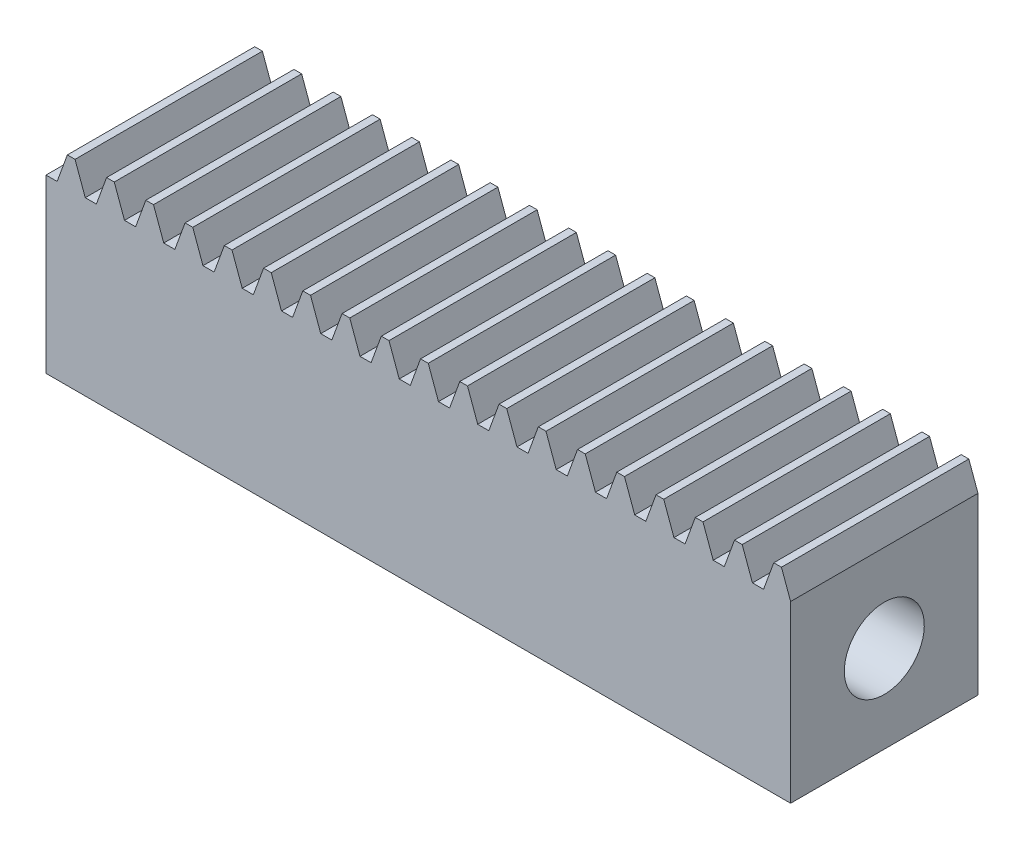
from build123d import *

# Parameters (mm, degrees)
BLANKSKE_W         = 100
BLANKSKE_H         = 16
BLANK_DEPTH        = 15
TOOTHCUTSIM_DEPTH  = 103.376755174
TEETHCUTS_COUNT    = 33
TEETHCUTS_PITCH    = 3.14159265
SKETCH1_R          = 3.2
CUT_EXTRUDE1_DEPTH = 50
SKETCH2_W          = 40.39626908
SKETCH2_H          = 26.250089156
CUT_EXTRUDE2_DEPTH = 103.376755174


with BuildPart() as part:
    # BlankSke → Blank (new body)
    with BuildSketch(Plane.XY):
        with Locations((50, 8)):
            Rectangle(BLANKSKE_W, BLANKSKE_H)
    extrude(amount=-BLANK_DEPTH)

    # TooCutSkeSim → ToothCutSim (cut, through all)
    with BuildSketch(Plane.XY):
        Polygon((0.44443537, 13.75), (-0.44443537, 13.75), (-1.272613241, 16.0254), (1.272613241, 16.0254), align=None)
    toothcutsim = extrude(amount=-TOOTHCUTSIM_DEPTH, mode=Mode.SUBTRACT)

    # TeethCuts: ToothCutSim ×33
    with Locations(*[(i * TEETHCUTS_PITCH, 0, 0) for i in range(1, TEETHCUTS_COUNT)]):
        add(toothcutsim, mode=Mode.SUBTRACT)

    # Sketch1 → Cut-Extrude1 (cut)
    with BuildSketch(Plane(origin=(100, 0, 0), x_dir=(0, 0, -1), z_dir=(1, 0, 0))):
        with Locations((7.5, 6.993868828)):
            Circle(SKETCH1_R)
    extrude(amount=-CUT_EXTRUDE1_DEPTH, mode=Mode.SUBTRACT)

    # Sketch2 → Cut-Extrude2 (cut, through all)
    with BuildSketch(Plane.XY):
        with Locations((20.19813454, 13.125044578)):
            Rectangle(SKETCH2_W, SKETCH2_H)
    extrude(amount=-CUT_EXTRUDE2_DEPTH, mode=Mode.SUBTRACT)


solid = part.part
